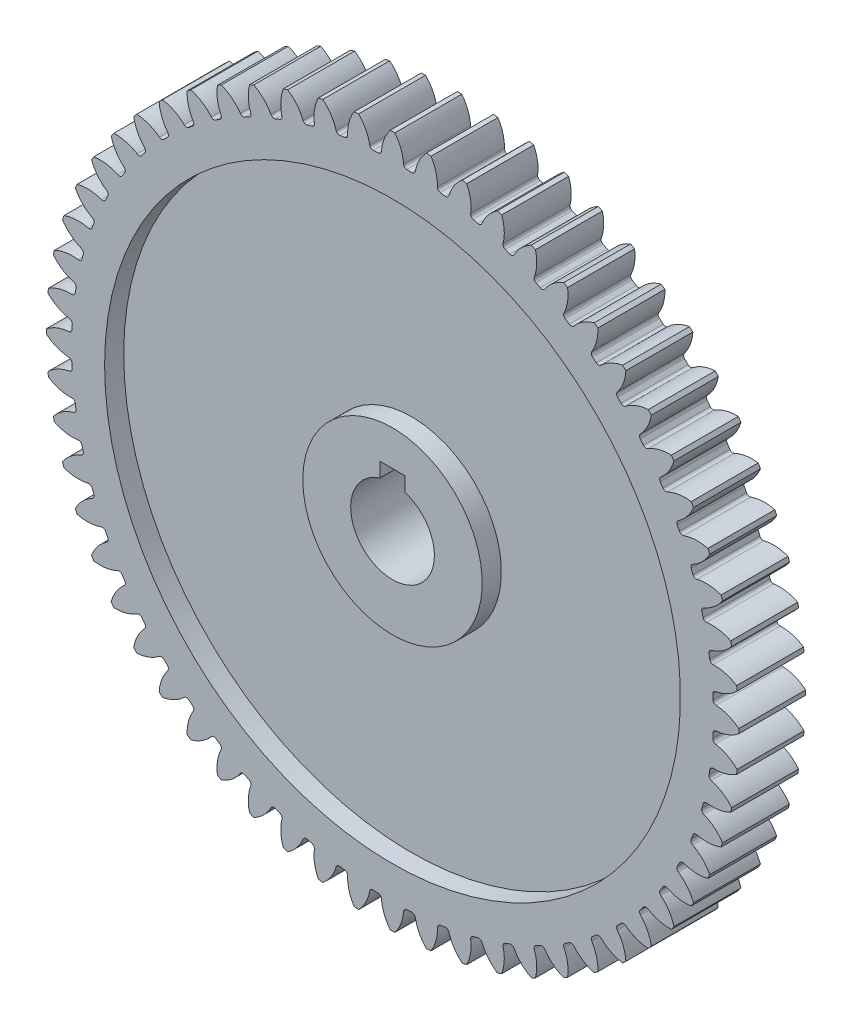
from build123d import *

# Parameters (mm, degrees)
CUT_EXTRUDE1_DEPTH = 49.566534429
CIRPATTERN1_COUNT  = 60
SKETCH5_W          = 2.38125
SKETCH5_H          = 2.38125
CUT_EXTRUDE2_DEPTH = 49.566534429


with BuildPart() as part:
    # Sketch3 → Revolve1 (revolve)
    with BuildSketch(Plane(origin=(0, 0, 0), x_dir=(0, 0, -1), z_dir=(1, 0, 0))):
        Polygon((-7.112, 32.83585), (-0.762, 32.83585), (-0.762, 27.305), (-2.576285714, 27.305), (-2.576285714, 8.509), (7.112, 8.509), (7.112, 3.96875), (-7.112, 3.96875), (-7.112, 8.509), (-5.297714286, 8.509), (-5.297714286, 27.305), (-7.112, 27.305), align=None)
    revolve(axis=Axis((0, 0, -7.112), (0, 0, 1)))

    # Sketch4 → Cut-Extrude1 (cut, symmetric)
    with BuildSketch(Plane.XY.offset(7.112)):
        with BuildLine():
            ThreePointArc((-0.216588191, 32.835135675), (-0.798258229, 31.826398587), (-1.055754581, 30.690799109))
            ThreePointArc((-1.055754581, 30.690799109), (-1.151101354, 30.486277626), (-1.358237494, 30.396752969))
            ThreePointArc((-1.358237494, 30.396752969), (-1.592430502, 30.385384073), (-1.82652895, 30.372210854))
            ThreePointArc((-1.82652895, 30.372210854), (-2.04188825, 30.439593463), (-2.158091021, 30.633028104))
            ThreePointArc((-2.158091021, 30.633028104), (-2.532879248, 31.735490952), (-3.216804575, 32.677900997))
            ThreePointArc((-3.216804575, 32.677900997), (-1.718495609, 32.790849609), (-0.216588191, 32.835135675))
        make_face()
    cut_extrude1 = extrude(amount=CUT_EXTRUDE1_DEPTH, both=True, mode=Mode.SUBTRACT)

    # CirPattern1: Cut-Extrude1 ×60 about axis
    cirpattern1_axis = Axis((0, 0, -7.112), (0, 0, -1))
    for i in range(1, CIRPATTERN1_COUNT):
        add(cut_extrude1.rotate(cirpattern1_axis, i * 360 / CIRPATTERN1_COUNT), mode=Mode.SUBTRACT)

    # Sketch5 → Cut-Extrude2 (cut, through all)
    with BuildSketch(Plane(origin=(0, 0, -7.112), x_dir=(-1, 0, 0), z_dir=(0, 0, -1))):
        with Locations((0, 3.96875)):
            Rectangle(SKETCH5_W, SKETCH5_H)
    extrude(amount=-CUT_EXTRUDE2_DEPTH, mode=Mode.SUBTRACT)


solid = part.part
